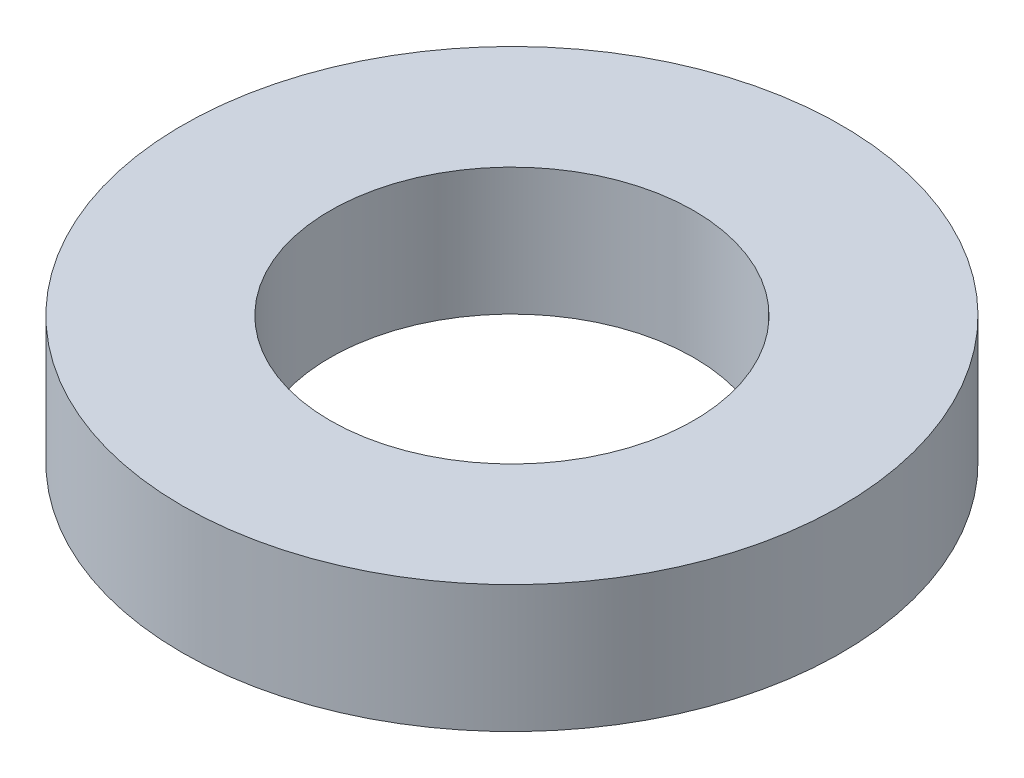
from build123d import *

# Parameters (mm, degrees)
SKETCH1_R           = 72.5
BOSS_EXTRUDE1_DEPTH = 28
SKETCH2_R           = 40
CUT_EXTRUDE1_DEPTH  = 107.284994237


with BuildPart() as part:
    # Sketch1 → Boss-Extrude1 (new body)
    with BuildSketch(Plane(origin=(0, 0, 0), x_dir=(1, 0, 0), z_dir=(0, 1, 0))):
        Circle(SKETCH1_R)
    extrude(amount=BOSS_EXTRUDE1_DEPTH)

    # Sketch2 → Cut-Extrude1 (cut, through all)
    with BuildSketch(Plane(origin=(0, 0, 0), x_dir=(1, 0, 0), z_dir=(0, 1, 0))):
        Circle(SKETCH2_R)
    extrude(amount=CUT_EXTRUDE1_DEPTH, mode=Mode.SUBTRACT)


solid = part.part
